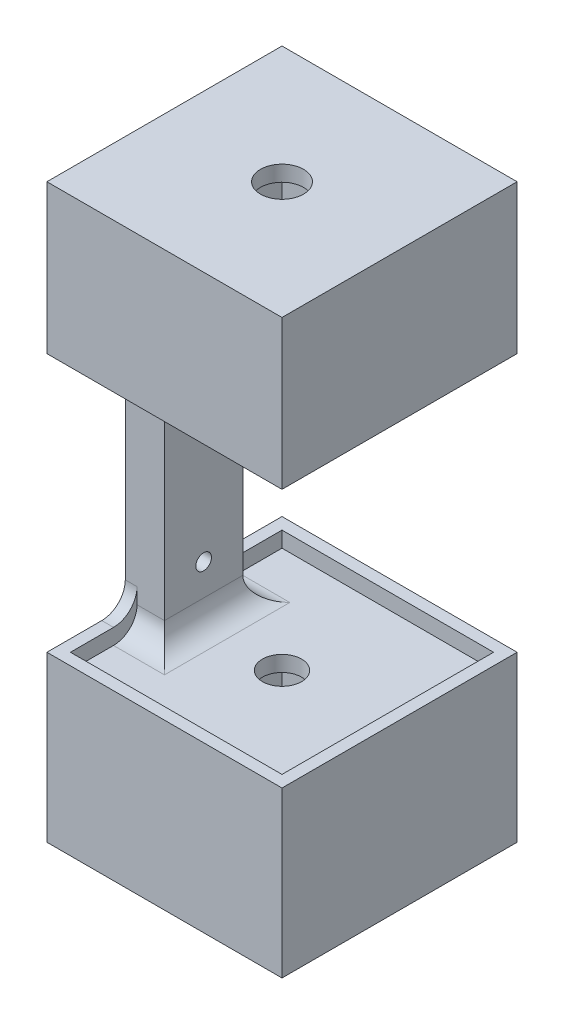
from build123d import *

# Parameters (mm, degrees)
SKETCH_2_W          = 30
SKETCH_2_H          = 30
EXTRUDE_1_DEPTH     = 2
SKETCH_3_W          = 30
SKETCH_3_H          = 30
SKETCH_3_W_2        = 26
SKETCH_3_H_2        = 26
EXTRUDE_2_DEPTH     = 15
SKETCH_4_W          = 30
SKETCH_4_H          = 30
SKETCH_4_W_2        = 27
SKETCH_4_H_2        = 27
EXTRUDE_3_DEPTH     = 2
SKETCH_5_W          = 5
SKETCH_5_H          = 10
EXTRUDE_2_2_DEPTH   = 35
SKETCH_6_R          = 1
CUT_EXTRUDE_1_DEPTH = 50.939963957
SKETCH_8_R          = 2.5
CUT_EXTRUDE_2_DEPTH = 41.926763859
FILLET_1_R          = 3
FILLET_2_R          = 3
SKETCH_9_W          = 30
SKETCH_9_H          = 30
EXTRUDE_3_2_DEPTH   = 2
SKETCH_10_W         = 30
SKETCH_10_H         = 30
SKETCH_10_W_2       = 26
SKETCH_10_H_2       = 26
EXTRUDE_4_DEPTH     = 15
SKETCH_11_R         = 1.75
CUT_EXTRUDE_3_DEPTH = 3
FILLET_3_R          = 3
SKETCH_13_W         = 30
SKETCH_13_H         = 30
EXTRUDE_4_2_DEPTH   = 2
SKETCH_14_W         = 30
SKETCH_14_H         = 30
EXTRUDE_5_DEPTH     = 2
SKETCH_15_R         = 2.75
CUT_EXTRUDE_4_DEPTH = 2


with BuildPart() as part:
    # Эскиз2 → Бобышка-Вытянуть1 (new body)
    with BuildSketch(Plane(origin=(0, 0, 0), x_dir=(1, 0, 0), z_dir=(0, 1, 0))):
        Rectangle(SKETCH_2_W, SKETCH_2_H)
    extrude(amount=EXTRUDE_1_DEPTH)

    # Эскиз3 → Extrude 2 (add)
    with BuildSketch(Plane.XZ):
        Rectangle(SKETCH_3_W, SKETCH_3_H)
        Rectangle(SKETCH_3_W_2, SKETCH_3_H_2, mode=Mode.SUBTRACT)
    extrude(amount=EXTRUDE_2_DEPTH)

    # Эскиз4 → Extrude 3 (add)
    with BuildSketch(Plane(origin=(0, 2, 0), x_dir=(1, 0, 0), z_dir=(0, 1, 0))):
        Rectangle(SKETCH_4_W, SKETCH_4_H)
        Rectangle(SKETCH_4_W_2, SKETCH_4_H_2, mode=Mode.SUBTRACT)
    extrude(amount=EXTRUDE_3_DEPTH)

    # Эскиз5 → Extrude 2 2 (add)
    with BuildSketch(Plane(origin=(0, 2, 0), x_dir=(1, 0, 0), z_dir=(0, 1, 0))):
        with Locations((-12.5, 0)):
            Rectangle(SKETCH_5_W, SKETCH_5_H)
    extrude(amount=EXTRUDE_2_2_DEPTH)

    # Эскиз6 → Вырез-Вытянуть1 (cut, through all)
    with BuildSketch(Plane.ZY.offset(15)):
        with Locations((0, 29)):
            Circle(SKETCH_6_R)
        with Locations((0, 9)):
            Circle(SKETCH_6_R)
    extrude(amount=-CUT_EXTRUDE_1_DEPTH, mode=Mode.SUBTRACT)

    # Эскиз8 → Вырез-Вытянуть2 (cut, through all)
    with BuildSketch(Plane(origin=(0, 2, 0), x_dir=(1, 0, 0), z_dir=(0, 1, 0))):
        with Locations(Location((0, 0, 0), (0, 0, 270))):
            Circle(SKETCH_8_R)
    extrude(amount=-CUT_EXTRUDE_2_DEPTH, mode=Mode.SUBTRACT)

    # Скругление1
    # the kernel refuses this fillet: 3 mm, written as the material it adds along each edge
    with BuildSketch(Plane(origin=(-10, 2, -5), x_dir=(1, 0, 0), z_dir=(0, 0, 1))) as fillet_1_piece_1:
        with BuildLine():
            CenterArc((FILLET_1_R, FILLET_1_R), FILLET_1_R, 180, 90)
            Line((0, FILLET_1_R), (0, 0))
            Line((0, 0), (FILLET_1_R, 0))
        make_face()
    extrude(amount=10)
    with BuildSketch(Plane(origin=(-21, 2, -5), x_dir=(0, 1, 0), z_dir=(1, 0, 0))) as fillet_1_piece_2_section:
        with BuildLine():
            CenterArc((FILLET_1_R, -FILLET_1_R), FILLET_1_R, 90, 90)
            Line((0, -FILLET_1_R), (0, 0))
            Line((0, 0), (FILLET_1_R, 0))
        make_face()
    fillet_1_piece_2 = extrude(amount=11, mode=Mode.PRIVATE)
    fillet_1_piece_2 = split(fillet_1_piece_2, bisect_by=Plane(origin=(-15, 2, -5), z_dir=(1, 0, 0)), keep=Keep.TOP, mode=Mode.PRIVATE)
    add(fillet_1_piece_2)
    with BuildSketch(Plane(origin=(-10, 2, 5), x_dir=(0, 1, 0), z_dir=(-1, 0, 0))) as fillet_1_piece_3_section:
        with BuildLine():
            CenterArc((FILLET_1_R, -FILLET_1_R), FILLET_1_R, 90, 90)
            Line((0, -FILLET_1_R), (0, 0))
            Line((0, 0), (FILLET_1_R, 0))
        make_face()
    fillet_1_piece_3 = extrude(amount=11, mode=Mode.PRIVATE)
    fillet_1_piece_3 = split(fillet_1_piece_3, bisect_by=Plane(origin=(-15, 2, 5), z_dir=(1, 0, 0)), keep=Keep.TOP, mode=Mode.PRIVATE)
    add(fillet_1_piece_3)
    with BuildSketch(Plane(origin=(-13.5, 2, -5), x_dir=(0, 1, 0), z_dir=(1, 0, 0))) as fillet_1_piece_4a_section:
        with BuildLine():
            CenterArc((FILLET_1_R, -FILLET_1_R), FILLET_1_R, 90, 90)
            Line((0, -FILLET_1_R), (0, 0))
            Line((0, 0), (FILLET_1_R, 0))
        make_face()
    fillet_1_piece_4a = extrude(amount=11, mode=Mode.PRIVATE)
    fillet_1_piece_4a = split(fillet_1_piece_4a, bisect_by=Plane(origin=(-10, 2, -5), z_dir=(1, 0, 0)), keep=Keep.TOP, mode=Mode.PRIVATE)
    with BuildSketch(Plane(origin=(-10, 2, -12.5), x_dir=(1, 0, 0), z_dir=(0, 0, 1))) as fillet_1_piece_4b_section:
        with BuildLine():
            CenterArc((FILLET_1_R, FILLET_1_R), FILLET_1_R, 180, 90)
            Line((0, FILLET_1_R), (0, 0))
            Line((0, 0), (FILLET_1_R, 0))
        make_face()
    fillet_1_piece_4b = extrude(amount=17.5, mode=Mode.PRIVATE)
    fillet_1_piece_4b = split(fillet_1_piece_4b, bisect_by=Plane(origin=(-10, 2, -5), z_dir=(0, 0, -1)), keep=Keep.TOP, mode=Mode.PRIVATE)
    fillet_1_piece_4 = fillet_1_piece_4a & fillet_1_piece_4b
    add(fillet_1_piece_4)
    with BuildSketch(Plane(origin=(-2.5, 2, 5), x_dir=(0, 1, 0), z_dir=(-1, 0, 0))) as fillet_1_piece_5a_section:
        with BuildLine():
            CenterArc((FILLET_1_R, -FILLET_1_R), FILLET_1_R, 90, 90)
            Line((0, -FILLET_1_R), (0, 0))
            Line((0, 0), (FILLET_1_R, 0))
        make_face()
    fillet_1_piece_5a = extrude(amount=11, mode=Mode.PRIVATE)
    fillet_1_piece_5a = split(fillet_1_piece_5a, bisect_by=Plane(origin=(-10, 2, 5), z_dir=(1, 0, 0)), keep=Keep.TOP, mode=Mode.PRIVATE)
    with BuildSketch(Plane(origin=(-10, 2, -5), x_dir=(1, 0, 0), z_dir=(0, 0, 1))) as fillet_1_piece_5b_section:
        with BuildLine():
            CenterArc((FILLET_1_R, FILLET_1_R), FILLET_1_R, 180, 90)
            Line((0, FILLET_1_R), (0, 0))
            Line((0, 0), (FILLET_1_R, 0))
        make_face()
    fillet_1_piece_5b = extrude(amount=17.5, mode=Mode.PRIVATE)
    fillet_1_piece_5b = split(fillet_1_piece_5b, bisect_by=Plane(origin=(-10, 2, 5), z_dir=(0, 0, 1)), keep=Keep.TOP, mode=Mode.PRIVATE)
    fillet_1_piece_5 = fillet_1_piece_5a & fillet_1_piece_5b
    add(fillet_1_piece_5)

    # Скругление2
    # the kernel refuses this fillet: 3 mm, written as the material it adds along each edge
    with BuildSketch(Plane(origin=(-13.5, 4, -5.171572875), x_dir=(0, 0.9983685980477195, 0.0570976569767209), z_dir=(-1, 0, 0)), Plane(origin=(-15, 4, 5.171572875), x_dir=(0, 0.9983685980477195, -0.0570976569767209), z_dir=(1, 0, 0))) as fillet_2_piece_1:
        with BuildLine():
            CenterArc((2.833609232, 2.995105794), FILLET_2_R, 183.273234946, 90)
            Line((-0.161496562, 2.823812823), (-0.461007141, 2.806683526))
            Line((-0.461007141, 2.806683526), (-0.299510579, -0.017129297))
            Line((-0.299510579, -0.017129297), (-0.083687204, -0.288091048))
            ThreePointArc((-0.083687204, -0.288091048), (1.025294304, -0.413705893), (3.0220315, -0.299510579))
            Line((3.0220315, -0.299510579), (3.004902203, 0))
        make_face()
    extrude(amount=1.5)

    # Эскиз9 → Extrude 3 2 (add)
    with BuildSketch(Plane(origin=(0, 37, 0), x_dir=(1, 0, 0), z_dir=(0, 1, 0))):
        Rectangle(SKETCH_9_W, SKETCH_9_H)
    extrude(amount=EXTRUDE_3_2_DEPTH)

    # Эскиз10 → Extrude 4 (add)
    with BuildSketch(Plane(origin=(0, 39, 0), x_dir=(1, 0, 0), z_dir=(0, 1, 0))):
        Rectangle(SKETCH_10_W, SKETCH_10_H)
        Rectangle(SKETCH_10_W_2, SKETCH_10_H_2, mode=Mode.SUBTRACT)
    extrude(amount=EXTRUDE_4_DEPTH)

    # Эскиз11 → Вырез-Вытянуть3 (cut)
    with BuildSketch(Plane(origin=(0, 39, 0), x_dir=(1, 0, 0), z_dir=(0, 1, 0))):
        with Locations(Location((0, 0, 0), (0, 0, 270))):
            Circle(SKETCH_11_R)
    extrude(amount=-CUT_EXTRUDE_3_DEPTH, mode=Mode.SUBTRACT)

    # Скругление3
    fillet_3_edges = [part.edges().sort_by_distance(p)[0] for p in [
        (-10, 37, 0),
        (-12.5, 37, -5),
        (-12.5, 37, 5),
    ]]
    fillet(fillet_3_edges, radius=FILLET_3_R)

    # Эскиз13 → Extrude 4 2 (add)
    with BuildSketch(Plane.XZ.offset(15)):
        Rectangle(SKETCH_13_W, SKETCH_13_H)
    extrude(amount=EXTRUDE_4_2_DEPTH)

    # Эскиз14 → Бобышка-Вытянуть5 (add)
    with BuildSketch(Plane(origin=(0, 54, 0), x_dir=(1, 0, 0), z_dir=(0, 1, 0))):
        Rectangle(SKETCH_14_W, SKETCH_14_H)
    extrude(amount=EXTRUDE_5_DEPTH)

    # Эскиз15 → Вырез-Вытянуть4 (cut)
    with BuildSketch(Plane(origin=(0, 56, 0), x_dir=(1, 0, 0), z_dir=(0, 1, 0))):
        with Locations(Location((0, 0, 0), (0, 0, 270))):
            Circle(SKETCH_15_R)
    extrude(amount=-CUT_EXTRUDE_4_DEPTH, mode=Mode.SUBTRACT)


solid = part.part
